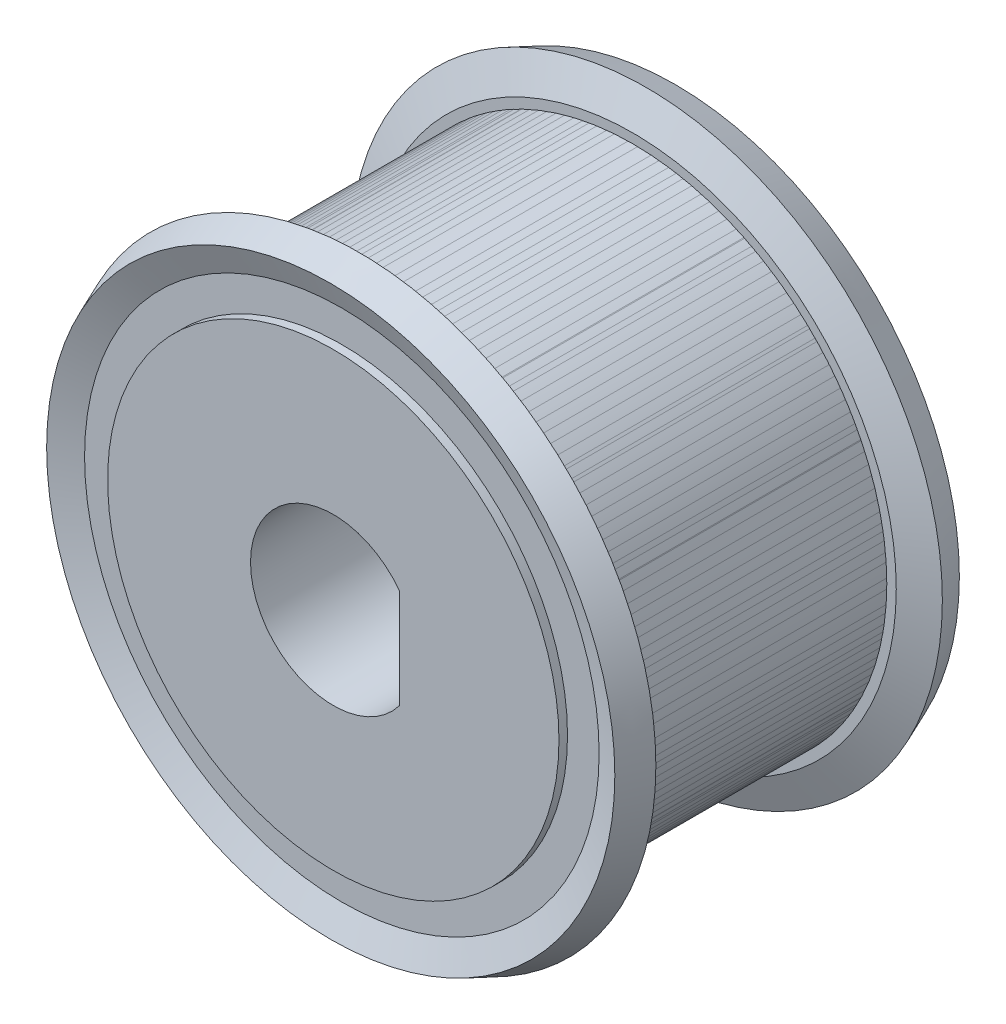
from build123d import *

# Parameters (mm, degrees)
TOOTHEXTRUDECUTGEARBELT01_DEPTH = 7.835899882
PATTERNGEARBELT01_COUNT         = 20
CUT_EXTRUDE_2_DEPTH             = 33.653112707
CUT_EXTRUDE_2_DEPTH_BACK        = 33.653112707


with BuildPart() as part:
    # SketchRevolveGearBelt01 → GearBelt01 (revolve)
    with BuildSketch(Plane(origin=(0, 0, 0), x_dir=(0, 0, -1), z_dir=(1, 0, 0))):
        Polygon((10.248899846, 0), (10.248899846, 13.629487395), (9.733279854, 13.629487395), (9.733279854, 15.538075019), (10.404229789, 17.157891451), (8.651279268, 17.883987331), (7.835899882, 15.915487361), (7.835899882, 15.34398737), (-7.835899882, 15.34398737), (-7.835899882, 15.915487361), (-8.651279268, 17.883987331), (-10.404229789, 17.157891451), (-9.733279854, 15.538075019), (-9.733279854, 13.629487395), (-10.248899846, 13.629487395), (-10.248899846, 0), align=None)
    revolve(axis=Axis((0, 0, 0), (0, 0, -1)))

    # SketchToothGearBelt01 → ToothExtrudeCutGearBelt01 (cut, symmetric)
    with BuildSketch(Plane.XY):
        with BuildLine():
            ThreePointArc((15.189205, 2.169993229), (15.343429185, 0), (15.189205, -2.169993229))
            add(Edge.make_bspline(
                [(15.189205, -2.169993229), (15.193305534, -2.141313845), (15.195757164, -2.097767751), (15.191587416, -2.039923228), (15.184765217, -1.996965665), (15.174297611, -1.954748066), (15.160261262, -1.913579187), (15.14275879, -1.873760103), (15.121918204, -1.835582022), (15.097891913, -1.79932415), (15.070855629, -1.76525165), (15.041007075, -1.733613699), (15.008564541, -1.704641692), (14.973765287, -1.678547436), (14.936863807, -1.655522038), (14.898129981, -1.635732867), (14.85784704, -1.619328456), (14.81630973, -1.606414559), (14.773821272, -1.597138675), (14.730694457, -1.591370625), (14.673606872, -1.58942772), (14.597833368, -1.590802706), (14.50329241, -1.587292017), (14.404301405, -1.575300386), (14.30654119, -1.555720458), (14.210619671, -1.528503959), (14.117125097, -1.493863505), (14.026633028, -1.452000056), (13.939699952, -1.403174359), (13.856860629, -1.347685871), (13.778624594, -1.285876137), (13.705473083, -1.218125284), (13.637856039, -1.144850065), (13.576189416, -1.066501192), (13.520852365, -0.98356059), (13.472185868, -0.896538423), (13.430487022, -0.805969981), (13.396020714, -0.71241229), (13.368967603, -0.616441044), (13.34961107, -0.518645741), (13.337633617, -0.419630986), (13.334152945, -0.299855766), (13.335612406, -0.160003622), (13.335055896, 0), (13.335612406, 0.160003622), (13.334152945, 0.299855766), (13.337633617, 0.419630986), (13.34961107, 0.518645741), (13.368967603, 0.616441044), (13.396020714, 0.71241229), (13.430487022, 0.805969981), (13.472185868, 0.896538423), (13.520852365, 0.98356059), (13.576189416, 1.066501192), (13.637856039, 1.144850065), (13.705473083, 1.218125284), (13.778624594, 1.285876137), (13.856860629, 1.347685871), (13.939699952, 1.403174359), (14.026633028, 1.452000056), (14.117125097, 1.493863505), (14.210619671, 1.528503959), (14.30654119, 1.555720458), (14.404301405, 1.575300386), (14.50329241, 1.587292017), (14.597833368, 1.590802706), (14.673606872, 1.58942772), (14.730694457, 1.591370625), (14.773821272, 1.597138675), (14.81630973, 1.606414559), (14.85784704, 1.619328456), (14.898129981, 1.635732867), (14.936863807, 1.655522038), (14.973765287, 1.678547436), (15.008564541, 1.704641692), (15.041007075, 1.733613699), (15.070855629, 1.76525165), (15.097891913, 1.79932415), (15.121918204, 1.835582022), (15.14275879, 1.873760103), (15.160261262, 1.913579187), (15.174297611, 1.954748066), (15.184765217, 1.996965665), (15.191587416, 2.039923228), (15.195757164, 2.097767751), (15.193305534, 2.141313845), (15.189205, 2.169993229)],
                knots=[0, 0, 0, 0, 0.013304592, 0.019956888, 0.026609185, 0.033261481, 0.039913777, 0.046566073, 0.053218369, 0.059870665, 0.066522961, 0.073175258, 0.079827554, 0.08647985, 0.093132146, 0.099784442, 0.106436738, 0.113089034, 0.11974133, 0.126393627, 0.133045923, 0.145957551, 0.161209637, 0.176461722, 0.191713808, 0.206965894, 0.222217979, 0.237470065, 0.252722151, 0.267974236, 0.283226322, 0.298478408, 0.313730493, 0.328982579, 0.344234665, 0.35948675, 0.374738836, 0.389990922, 0.405243007, 0.420495093, 0.435747179, 0.450999264, 0.475499632, 0.5, 0.524500368, 0.549000736, 0.564252821, 0.579504907, 0.594756993, 0.610009078, 0.625261164, 0.64051325, 0.655765335, 0.671017421, 0.686269507, 0.701521592, 0.716773678, 0.732025764, 0.747277849, 0.762529935, 0.777782021, 0.793034106, 0.808286192, 0.823538278, 0.838790363, 0.854042449, 0.866954077, 0.873606373, 0.88025867, 0.886910966, 0.893563262, 0.900215558, 0.906867854, 0.91352015, 0.920172446, 0.926824742, 0.933477039, 0.940129335, 0.946781631, 0.953433927, 0.960086223, 0.966738519, 0.973390815, 0.980043112, 0.986695408, 1, 1, 1, 1], degree=3))
        make_face()
    toothextrudecutgearbelt01 = extrude(amount=TOOTHEXTRUDECUTGEARBELT01_DEPTH, both=True, mode=Mode.SUBTRACT)

    # PatternGearBelt01: ToothExtrudeCutGearBelt01 ×20 about axis
    patterngearbelt01_axis = Axis((0, 0, 55), (0, 0, -1))
    for i in range(1, PATTERNGEARBELT01_COUNT):
        add(toothextrudecutgearbelt01.rotate(patterngearbelt01_axis, i * 360 / PATTERNGEARBELT01_COUNT), mode=Mode.SUBTRACT)

    # 草图5 → 切除-拉伸2 (cut, two sides: drawn at the far end of the back side and taken through both)
    with BuildSketch(Plane.XY.offset(10.248899846).offset(-CUT_EXTRUDE_2_DEPTH_BACK)):
        with BuildLine():
            Line((4, -3), (4, 3))
            ThreePointArc((4, 3), (-5, 0), (4, -3))
        make_face()
    extrude(amount=CUT_EXTRUDE_2_DEPTH + CUT_EXTRUDE_2_DEPTH_BACK, mode=Mode.SUBTRACT)


solid = part.part
